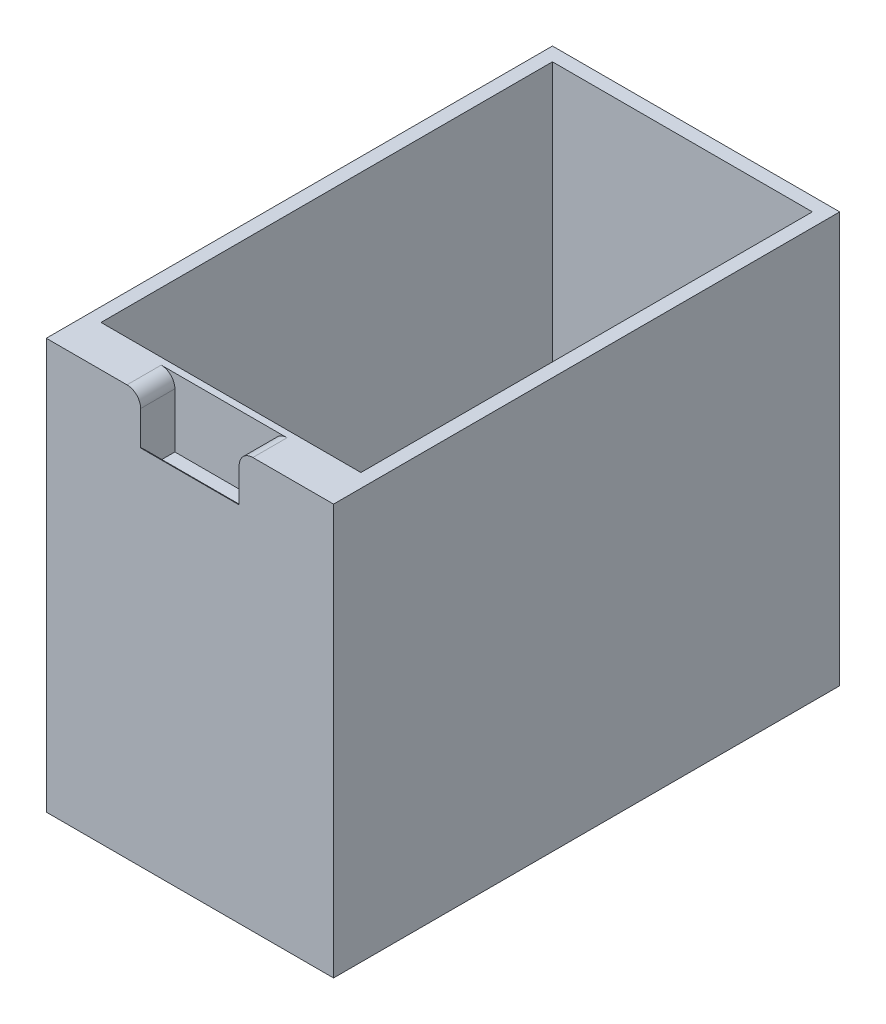
from build123d import *

# Parameters (mm, degrees)
ESQUISSE1_W             = 210
ESQUISSE1_H             = 300
BOSS_EXTRU_1_DEPTH      = 370
ESQUISSE2_W             = 190
ESQUISSE2_H             = 330
ENL_V_MAT_EXTRU_1_DEPTH = 280
ESQUISSE5_W             = 72
ESQUISSE5_H             = 25
ENL_V_MAT_EXTRU_4_DEPTH = 35
ESQUISSE6_W             = 72
ESQUISSE6_H             = 20
ENL_V_MAT_EXTRU_5_DEPTH = 15
CONG_5_R                = 10
CONG_6_R                = 10
CONG_7_R                = 10


with BuildPart() as part:
    # Esquisse1 → Boss.-Extru.1 (new body)
    with BuildSketch(Plane.XY):
        with Locations((-8.883179232, -107.447368421)):
            Rectangle(ESQUISSE1_W, ESQUISSE1_H)
    extrude(amount=-BOSS_EXTRU_1_DEPTH)

    # Esquisse2 → Enlèv. mat.-Extru.1 (cut)
    with BuildSketch(Plane(origin=(0, 42.552631579, 0), x_dir=(1, 0, 0), z_dir=(0, 1, 0))):
        with Locations((-8.883179232, 195)):
            Rectangle(ESQUISSE2_W, ESQUISSE2_H)
    extrude(amount=-ENL_V_MAT_EXTRU_1_DEPTH, mode=Mode.SUBTRACT)

    # Esquisse5 → Enlèv. mat.-Extru.4 (cut)
    with BuildSketch(Plane(origin=(0, 42.552631579, 0), x_dir=(1, 0, 0), z_dir=(0, 1, 0))):
        with Locations((-8.883179232, 12.5)):
            Rectangle(ESQUISSE5_W, ESQUISSE5_H)
    extrude(amount=-ENL_V_MAT_EXTRU_4_DEPTH, mode=Mode.SUBTRACT)

    # Esquisse6 → Enlèv. mat.-Extru.5 (cut)
    with BuildSketch(Plane(origin=(0, 7.552631579, 0), x_dir=(1, 0, 0), z_dir=(0, 1, 0))):
        with Locations((-8.883179232, 15)):
            Rectangle(ESQUISSE6_W, ESQUISSE6_H)
    extrude(amount=-ENL_V_MAT_EXTRU_5_DEPTH, mode=Mode.SUBTRACT)

    # Congé5
    cong_5_edges = [part.edges().sort_by_distance(p)[0] for p in [
        (27.116820768, 42.552631579, -12.5),
    ]]
    fillet(cong_5_edges, radius=CONG_5_R)

    # Congé6
    cong_6_edges = [part.edges().sort_by_distance(p)[0] for p in [
        (-44.883179232, 42.552631579, -12.5),
    ]]
    fillet(cong_6_edges, radius=CONG_6_R)

    # Congé7
    # the kernel refuses this fillet: 10 mm, written as the material it takes off along each edge
    with BuildSketch(Plane(origin=(27.116820768, 7.552631579, -5), x_dir=(0, -1, 0), z_dir=(-1, 0, 0))) as cong_7_piece_1:
        with BuildLine():
            CenterArc((8.660254038, 10), CONG_7_R, 210, 60)
            Line((0, 5), (-0.173205081, 4.9))
            ThreePointArc((-0.173205081, 4.9), (-0.2, 2.5), (-0.2, 0))
            Line((-0.2, 0), (0, -0.2))
            Line((0, -0.2), (8.660254038, -0.2))
            Line((8.660254038, -0.2), (8.660254038, 0))
        make_face()
    extrude(amount=72, mode=Mode.SUBTRACT)


solid = part.part
